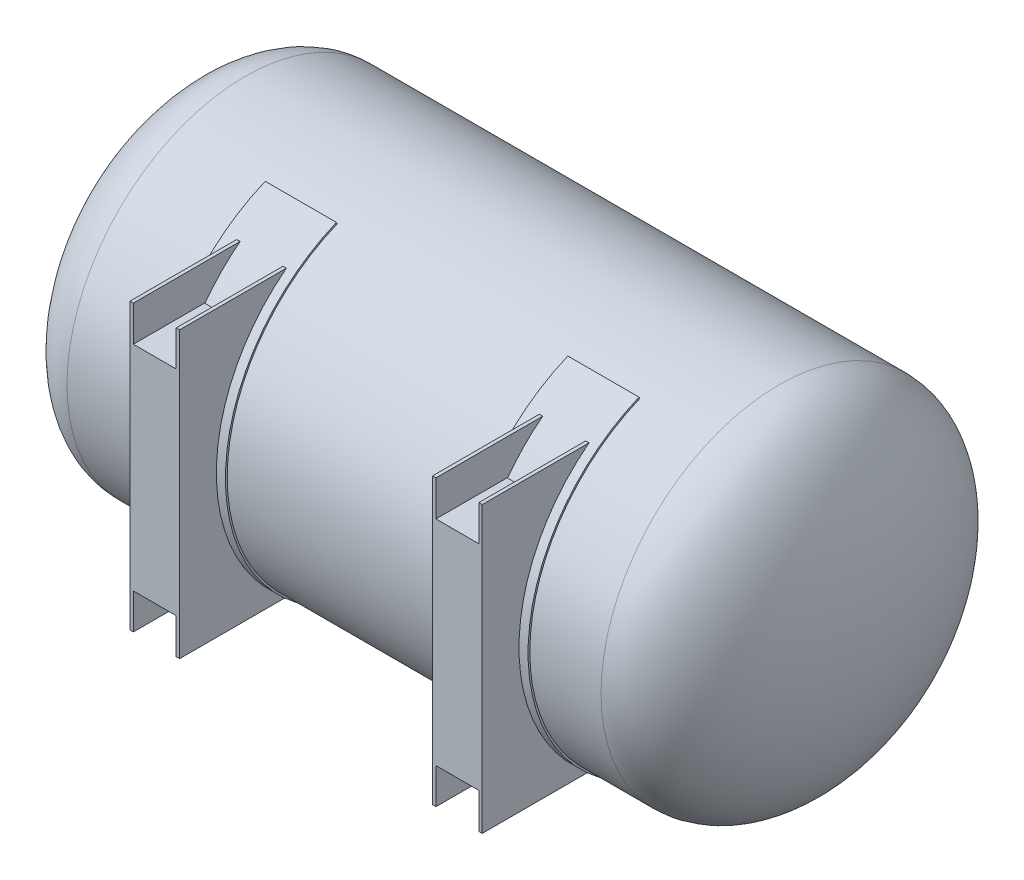
from build123d import *

# Parameters (mm, degrees)
REVOLU_O_FINA1_OUTLINE_W    = 9.51
REVOLU_O_FINA1_OUTLINE_H    = 1500
REVOLU_O_FINA1_OUTLINE_H_2  = 240.444341539
EXTRUS_O_FINA1_DEPTH        = 200
RESSALTO_EXTRUS_O1_DEPTH    = 9.51
PADR_O_LINEAR1_COUNT        = 2
PADR_O_LINEAR1_PITCH        = 130
ESBO_O6_W                   = 120.49
ESBO_O6_H                   = 200
RESSALTO_EXTRUS_O3_DEPTH    = 600
PADR_O_LINEAR2_COUNT        = 2
PADR_O_LINEAR2_PITCH        = 850
PADR_O_LINEAR2_COPY_1_DEPTH = 9.51


# Read off the part's stored shape, not the designer's step: Revolução-Fina1
with BuildPart() as part:
    # Revolução-Fina1 outline → Revolução-Fina1 (revolve)
    with BuildSketch(Plane.YX):
        with Locations((495.245, 0)):
            Rectangle(REVOLU_O_FINA1_OUTLINE_W, REVOLU_O_FINA1_OUTLINE_H)
        with BuildLine():
            add(Edge.make_bspline(
                [(500, -750), (500, -774.496566651), (490.49, -798.527208605)],
                knots=[0, 0, 0, 0.209180689, 0.209180689, 0.209180689], degree=2, weights=[1, 0.960995831, 0.93237992]))
            Line((500, -750), (490.49, -750))
            Line((490.49, -750), (490.49, -798.527208605))
        make_face()
        with BuildLine():
            add(Edge.make_bspline(
                [(490.49, -798.527208605), (431.114104825, -948.563052731), (136.916304681, -990.444341539)],
                knots=[0.209180689, 0.209180689, 0.209180689, 1.277666813, 1.277666813, 1.277666813], degree=2, weights=[0.93237992, 0.786211057, 0.911084654]))
            Line((490.49, -798.527208605), (490.49, -750))
            add(Edge.make_bspline(
                [(490.49, -750), (490.49, -756.170140316), (489.996533297, -762.250209718), (488.097100707, -774.243792936), (486.69097575, -780.157277717), (484.396396219, -787.451130778), (483.910589502, -788.904993096), (482.885861705, -791.803022934), (482.346695727, -793.247460944), (480.664474944, -797.532745176), (479.452819365, -800.337309876), (475.569978174, -808.607264499), (472.651857761, -813.929459837), (466.24875421, -824.245133491), (462.763401959, -829.238397763), (458.093259703, -835.298211011), (457.142766617, -836.501970807), (455.214507391, -838.887646774), (454.23864601, -840.067257968), (451.277498036, -843.568250564), (449.258689452, -845.851838149), (443.079482681, -852.564173468), (438.796755516, -856.855003413), (429.951546793, -865.121258823), (425.38888672, -869.096483024), (416.017622138, -876.769645428), (411.208912061, -880.467464609), (403.83054145, -885.827822424), (401.343477985, -887.583483762), (396.316777727, -891.035533507), (393.774292837, -892.733703418), (380.994014923, -901.046037426), (370.524977357, -907.151589049), (349.1974984, -918.496902345), (338.338260557, -923.734893208), (316.291002589, -933.479869288), (305.102614398, -937.986036158), (282.437223231, -946.356671573), (270.960030701, -950.220718672), (256.450222565, -954.687661885), (253.538336447, -955.563337846), (247.709788904, -957.275748764), (244.792748493, -958.112630071), (236.033571984, -960.567010261), (230.183386909, -962.128289426), (212.602336547, -966.599127426), (200.841050343, -969.296205168), (177.244271874, -974.17205328), (165.408756971, -976.350665541), (141.668309217, -980.223026257), (129.763362931, -981.916680866), (105.887258171, -984.841517565), (93.916091914, -986.072645295), (57.906169654, -989.092538957), (33.771497094, -990.211356153), (9.51, -990.444341539)],
                knots=[0, 0, 0, 0, 0.03125, 0.03125, 0.0625, 0.0625, 0.0703125, 0.0703125, 0.078125, 0.078125, 0.09375, 0.09375, 0.125, 0.125, 0.15625, 0.15625, 0.1640625, 0.1640625, 0.171875, 0.171875, 0.1875, 0.1875, 0.21875, 0.21875, 0.25, 0.25, 0.28125, 0.28125, 0.296875, 0.296875, 0.3125, 0.3125, 0.375, 0.375, 0.4375, 0.4375, 0.5, 0.5, 0.5625, 0.5625, 0.578125, 0.578125, 0.59375, 0.59375, 0.625, 0.625, 0.6875, 0.6875, 0.75, 0.75, 0.8125, 0.8125, 0.875, 0.875, 1, 1, 1, 1], degree=3))
            Line((9.51, -990.444341539), (136.916304681, -990.444341539))
        make_face()
        with BuildLine():
            Line((490.49, 750), (500, 750))
            add(Edge.make_bspline(
                [(490.49, 798.527208605), (500, 774.496566651), (500, 750)],
                knots=[6.074004618, 6.074004618, 6.074004618, 6.283185307, 6.283185307, 6.283185307], degree=2, weights=[0.93237992, 0.960995831, 1]))
            Line((490.49, 798.527208605), (490.49, 750))
        make_face()
        with BuildLine():
            add(Edge.make_bspline(
                [(136.916304681, -990.444341539), (74.448563712, -999.337098383), (9.51, -999.95477586)],
                knots=[1.277666813, 1.277666813, 1.277666813, 1.549751414, 1.549751414, 1.549751414], degree=2, weights=[0.911084654, 0.942883086, 0.99225701]))
            Line((136.916304681, -990.444341539), (9.51, -990.444341539))
            Line((9.51, -990.444341539), (9.51, -999.95477586))
        make_face()
        with BuildLine():
            Line((490.49, 750), (490.49, 798.527208605))
            add(Edge.make_bspline(
                [(136.916304681, 990.444341539), (431.114104825, 948.563052731), (490.49, 798.527208605)],
                knots=[5.005518494, 5.005518494, 5.005518494, 6.074004618, 6.074004618, 6.074004618], degree=2, weights=[0.911084654, 0.786211057, 0.93237992]))
            Line((136.916304681, 990.444341539), (9.51, 990.444341539))
            add(Edge.make_bspline(
                [(9.51, 990.444341539), (33.780775711, 990.211267049), (57.892294378, 989.091973103), (93.820298091, 986.081539868), (105.756261685, 984.855264198), (129.546038597, 981.945570296), (141.399860302, 980.262198732), (165.021753274, 976.418279181), (176.789839289, 974.257813265), (200.234789458, 969.429258112), (211.911678465, 966.76130718), (235.166315249, 960.873712995), (246.744105501, 957.654306108), (269.789202706, 950.600684677), (281.256585749, 946.766893555), (295.511470599, 941.533128464), (298.358464154, 940.464208892), (304.044152459, 938.280189288), (306.884828404, 937.164286678), (315.378379916, 933.750496631), (320.998093173, 931.388664218), (337.720369475, 924.027310954), (348.686995097, 918.753800574), (364.815512274, 910.195692365), (370.137910672, 907.234605114), (378.032220339, 902.61300939), (380.648754698, 901.042441266), (385.850286857, 897.837741306), (388.431147325, 896.206109839), (396.098955581, 891.226957967), (401.116287161, 887.792308714), (410.942017461, 880.668388035), (415.75048558, 876.979201184), (425.13277249, 869.314865177), (429.70670404, 865.33985344), (438.585601226, 857.062046744), (442.890761004, 852.759488382), (449.11127054, 846.016543366), (451.148801442, 843.715962589), (455.107466323, 839.044221622), (457.030982638, 836.670845729), (462.623361287, 829.430997272), (466.114844207, 824.44533536), (470.942071834, 816.691346907), (472.482635157, 814.060647368), (474.68182157, 810.039569556), (475.396257543, 808.686694512), (476.786174104, 805.954768519), (477.462231609, 804.574486556), (480.734120635, 797.61799224), (482.975303025, 791.942638457), (486.637643148, 780.351894679), (488.059056396, 774.436579478), (489.265781112, 766.875573805), (489.478550877, 765.355008193), (489.845178883, 762.296632489), (489.998536966, 760.762439311), (490.366586699, 756.158983145), (490.49, 753.083026385), (490.49, 750)],
                knots=[0, 0, 0, 0, 0.125, 0.125, 0.1875, 0.1875, 0.25, 0.25, 0.3125, 0.3125, 0.375, 0.375, 0.4375, 0.4375, 0.5, 0.5, 0.515625, 0.515625, 0.53125, 0.53125, 0.5625, 0.5625, 0.625, 0.625, 0.65625, 0.65625, 0.671875, 0.671875, 0.6875, 0.6875, 0.71875, 0.71875, 0.75, 0.75, 0.78125, 0.78125, 0.8125, 0.8125, 0.828125, 0.828125, 0.84375, 0.84375, 0.875, 0.875, 0.890625, 0.890625, 0.8984375, 0.8984375, 0.90625, 0.90625, 0.9375, 0.9375, 0.96875, 0.96875, 0.9765625, 0.9765625, 0.984375, 0.984375, 1, 1, 1, 1], degree=3))
        make_face()
        with Locations((4.755, -870.22217077)):
            Rectangle(REVOLU_O_FINA1_OUTLINE_W, REVOLU_O_FINA1_OUTLINE_H_2)
        with BuildLine():
            Line((9.51, -999.95477586), (9.51, -990.444341539))
            Line((9.51, -990.444341539), (0, -990.444341539))
            Line((0, -990.444341539), (0, -1000))
            add(Edge.make_bspline(
                [(9.51, -999.95477586), (4.75543012, -1000), (0, -1000)],
                knots=[1.549751414, 1.549751414, 1.549751414, 1.570796327, 1.570796327, 1.570796327], degree=2, weights=[0.99225701, 0.996075932, 1]))
        make_face()
        with Locations((4.755, 0)):
            Rectangle(REVOLU_O_FINA1_OUTLINE_W, REVOLU_O_FINA1_OUTLINE_H)
        with BuildLine():
            Line((9.51, 990.444341539), (136.916304681, 990.444341539))
            add(Edge.make_bspline(
                [(9.51, 999.95477586), (74.448563712, 999.337098383), (136.916304681, 990.444341539)],
                knots=[4.733433893, 4.733433893, 4.733433893, 5.005518494, 5.005518494, 5.005518494], degree=2, weights=[0.99225701, 0.942883086, 0.911084654]))
            Line((9.51, 999.95477586), (9.51, 990.444341539))
        make_face()
        with BuildLine():
            Line((0, 990.444341539), (9.51, 990.444341539))
            Line((9.51, 990.444341539), (9.51, 999.95477586))
            add(Edge.make_bspline(
                [(0, 1000), (4.75543012, 1000), (9.51, 999.95477586)],
                knots=[4.71238898, 4.71238898, 4.71238898, 4.733433893, 4.733433893, 4.733433893], degree=2, weights=[1, 0.996075932, 0.99225701]))
            Line((0, 1000), (0, 990.444341539))
        make_face()
        with Locations((4.755, 870.22217077)):
            Rectangle(REVOLU_O_FINA1_OUTLINE_W, REVOLU_O_FINA1_OUTLINE_H_2)
    revolve(axis=Axis((0, 0, 0), (1, 0, 0)))



with BuildPart() as body_2:
    # Esboço3 → Extrusão-Fina1 (new body)
    with BuildSketch(Plane(origin=(350, 0, 0), x_dir=(0, 0, -1), z_dir=(1, 0, 0))):
        with BuildLine():
            ThreePointArc((-193.255133344, 466.559163918), (-505, 0), (-193.255133344, -466.559163918))
            Line((-193.255133344, -466.559163918), (-189.428299021, -457.320368593))
            ThreePointArc((-189.428299021, -457.320368593), (-495, 0), (-189.428299021, 457.320368593))
            Line((-189.428299021, 457.320368593), (-193.255133344, 466.559163918))
        make_face()
    extrus_o_fina1 = extrude(amount=EXTRUS_O_FINA1_DEPTH)


with BuildPart() as part_1:
    add(part.part)

    add(body_2.part)  # Ressalto-extrusão1 merges body 2
    # Esboço4 → Ressalto-extrusão1 (add)
    with BuildSketch(Plane(origin=(385, 0, 0), x_dir=(0, 0, -1), z_dir=(1, 0, 0))):
        with BuildLine():
            Line((-308.261252836, -400), (-608.261252836, -400))
            Line((-608.261252836, -400), (-608.261252836, 400))
            Line((-608.261252836, 400), (-308.261252836, 400))
            ThreePointArc((-308.261252836, 400), (-505, 0), (-308.261252836, -400))
        make_face()
    ressalto_extrus_o1 = extrude(amount=RESSALTO_EXTRUS_O1_DEPTH)

    # Padrão linear1: Ressalto-extrusão1 ×2
    with Locations(*[(i * PADR_O_LINEAR1_PITCH, 0, 0) for i in range(1, PADR_O_LINEAR1_COUNT)]):
        add(ressalto_extrus_o1)

    # Esboço6 → Ressalto-extrusão3 (add)
    with BuildSketch(Plane(origin=(0, 300, 0), x_dir=(1, 0, 0), z_dir=(0, 1, 0))):
        with Locations((454.755, -508.261252836)):
            Rectangle(ESBO_O6_W, ESBO_O6_H)
    ressalto_extrus_o3 = extrude(amount=-RESSALTO_EXTRUS_O3_DEPTH)

    # Padrão linear2: Extrusão-Fina1, Ressalto-extrusão1, Ressalto-extrusão3 ×2
    with Locations(*[(-i * PADR_O_LINEAR2_PITCH, 0, 0) for i in range(1, PADR_O_LINEAR2_COUNT)]):
        add(extrus_o_fina1)
        add(ressalto_extrus_o1)
        add(ressalto_extrus_o3)

    # Padrão linear2 copy 1 sketch → Padrão linear2 copy 1 (add)
    with BuildSketch(Plane(origin=(-335, 0, 0), x_dir=(0, 0, -1), z_dir=(1, 0, 0))):
        with BuildLine():
            Line((-308.261252836, -400), (-608.261252836, -400))
            Line((-608.261252836, -400), (-608.261252836, 400))
            Line((-608.261252836, 400), (-308.261252836, 400))
            ThreePointArc((-308.261252836, 400), (-505, 0), (-308.261252836, -400))
        make_face()
    extrude(amount=PADR_O_LINEAR2_COPY_1_DEPTH)


solid = part_1.part
